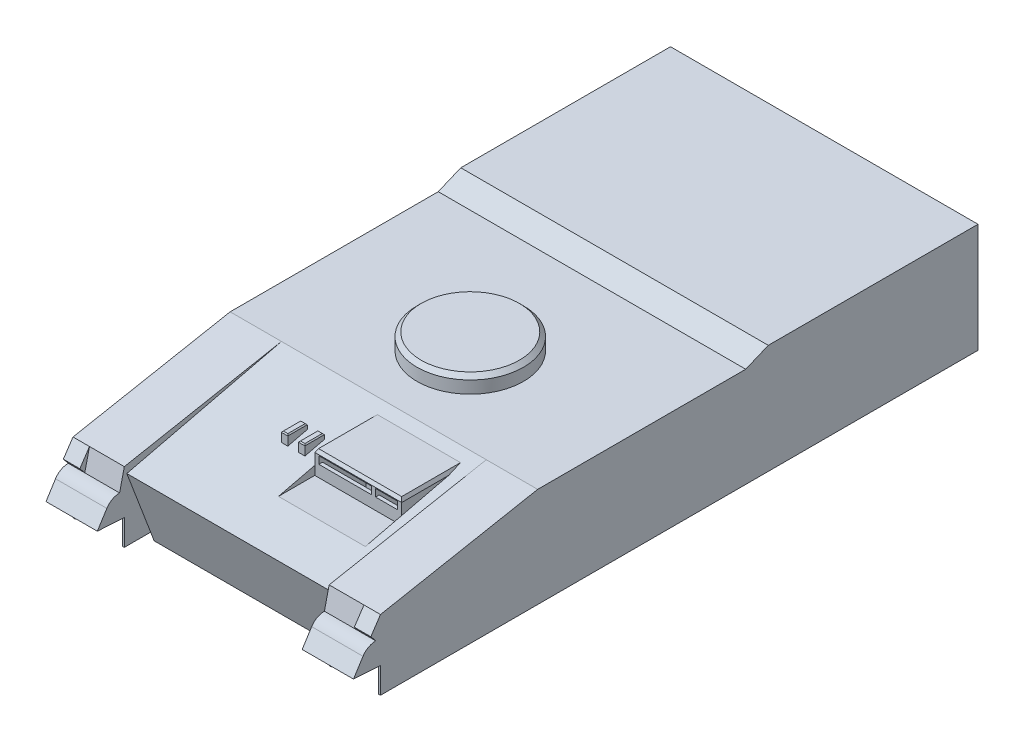
from build123d import *
from OCP.BRepAlgoAPI import BRepAlgoAPI_Cut
from OCP.TopTools import TopTools_ListOfShape
from OCP.BRepFilletAPI import BRepFilletAPI_MakeChamfer

# Parameters (mm, degrees)
BOSS_EXTRUDE1_DEPTH      = 193.56223071
BOSS_EXTRUDE1_DEPTH_BACK = 1265.039956588
SKETCH1_W                = 750.660133044
SKETCH1_H                = 349.862732427
SKETCH3_R                = 130
BOSS_EXTRUDE2_DEPTH      = 40
CUT_EXTRUDE1_DEPTH       = 1499.066357024
BOSS_EXTRUDE3_DEPTH      = 750.660133044
CHAMFER7_SIZE            = 10
BOSS_EXTRUDE4_DEPTH      = 750.660133044
CUT_EXTRUDE10_START      = -375.330067
CUT_EXTRUDE10_DEPTH      = 250
SKETCH22_W               = 125.330066522
SKETCH22_H               = 106.338336752
SKETCH22_W_2             = 115.330066522
SKETCH22_H_2             = 62.996013083
CUT_EXTRUDE11_DEPTH      = 1563.648643762
CUT_EXTRUDE12_REACH      = 1374.196
SKETCH24_W               = 115.330066522
SKETCH24_H               = 258.53466534
SKETCH25_W               = 115.330066522
SKETCH25_H               = 1190.067521958
CUT_EXTRUDE13_DEPTH      = 152.66709
BOSS_EXTRUDE5_REACH      = 1461.802
SKETCH27_W               = 212.123312066
SKETCH27_H               = 152.466183094
SKETCH28_W               = 148.280920275
SKETCH28_H               = 7.25471817
CUT_EXTRUDE14_DEPTH      = 212.123312065
SKETCH30_W               = 212.123312066
SKETCH30_H               = 21.209064542
CUT_EXTRUDE15_DEPTH      = 115
SKETCH31_W               = 128.313019002
SKETCH31_H               = 18.286786033
SKETCH31_W_2             = 53.810293064
CUT_EXTRUDE16_DEPTH      = 115
SKETCH32_W               = 128.313019002
SKETCH32_H               = 106.064247612
SKETCH32_W_2             = 53.810293064
CUT_EXTRUDE17_DEPTH      = 115
BOSS_EXTRUDE6_REACH      = 1500.066
CUT_EXTRUDE18_START      = -375.330067
CUT_EXTRUDE18_DEPTH      = 335
CHAMFER8_SIZE            = 8
CHAMFER8_SIZE2           = 4.618802154
BOSS_EXTRUDE7_REACH      = 1461.802
CHAMFER9_SIZE            = 2.5


with BuildPart() as part:
    # Sketch1 → Boss-Extrude1 (new, two sides: drawn at the far end of the back side and taken through both)
    with BuildSketch(Plane.XY.offset(-BOSS_EXTRUDE1_DEPTH_BACK)):
        with Locations((108.368558778, 68.593029462)):
            Rectangle(SKETCH1_W, SKETCH1_H)
    extrude(amount=BOSS_EXTRUDE1_DEPTH + BOSS_EXTRUDE1_DEPTH_BACK)

    # Sketch3 → Boss-Extrude2 (add)
    with BuildSketch(Plane(origin=(0, 243.524395675, 0), x_dir=(1, 0, 0), z_dir=(0, 1, 0))):
        with Locations(Location((108.368558778, 400.912813637, 0), (0, 0, 90))):
            Circle(SKETCH3_R)
    extrude(amount=BOSS_EXTRUDE2_DEPTH)

    # Sketch5 → Cut-Extrude1 (cut, through all)
    with BuildSketch(Plane(origin=(483.6986253, 0, 0), x_dir=(0, 0, -1), z_dir=(1, 0, 0))):
        Polygon((-193.56223071, 170.788945028), (190.086198144, 243.524395675), (-193.56223071, 243.524395675), align=None)
    extrude(amount=-CUT_EXTRUDE1_DEPTH, mode=Mode.SUBTRACT)

    # Sketch7 → Boss-Extrude3 (add)
    with BuildSketch(Plane(origin=(483.6986253, 0, 0), x_dir=(0, 0, -1), z_dir=(1, 0, 0))):
        Polygon((698.031406741, 243.524395675), (753.10995922, 266.522586582), (1265.039956588, 266.522586582), (1265.039956588, 243.524395675), align=None)
    extrude(amount=-BOSS_EXTRUDE3_DEPTH)

    # Chamfer7
    chamfer7_edges = [part.edges().sort_by_distance(p)[0] for p in [
        (108.368558778, 283.524395675, -270.912813637),
    ]]
    chamfer(chamfer7_edges, length=CHAMFER7_SIZE)

    # Sketch21 → Boss-Extrude4 (add)
    with BuildSketch(Plane.ZY.offset(266.961507744)):
        with BuildLine():
            Line((236.219336917, 103.762292304), (259.433344062, 67.111421995))
            Line((259.433344062, 67.111421995), (193.56223071, 62.996013083))
            Line((193.56223071, 62.996013083), (193.56223071, 120.885528527))
            Line((193.56223071, 120.885528527), (193.56223071, 170.788945028))
            Line((193.56223071, 170.788945028), (205.104812792, 120.885528527))
            ThreePointArc((205.104812792, 120.885528527), (222.862338171, 116.321994956), (236.219336917, 103.762292304))
        make_face()
    extrude(amount=-BOSS_EXTRUDE4_DEPTH)

    # Sketch20 → Cut-Extrude10 (cut, symmetric)
    with BuildSketch(Plane.ZY.offset(266.961507744).offset(CUT_EXTRUDE10_START)):
        Polygon((187.485453539, 153.18520382), (120.633916065, -22.69233968), (-169.800553019, -69.161854733), (-1166.369128547, -69.161854733), (-1265.039956588, 144.92983962), (-1265.039956588, -106.338336752), (316.242531376, -106.338336752), (316.242531376, 170.788945028), (193.56223071, 170.788945028), (-190.086198144, 243.524395675), align=None)
    extrude(amount=CUT_EXTRUDE10_DEPTH, both=True, mode=Mode.SUBTRACT)


with BuildPart() as cut_extrude11_tool:
    # Sketch22 → Cut-Extrude11 (new, through all)
    with BuildSketch(Plane.XY.offset(193.56223071)):
        with Locations((-204.296474483, -53.169168376)):
            Rectangle(SKETCH22_W, SKETCH22_H)
        with Locations((-204.296474483, 31.498006542)):
            Rectangle(SKETCH22_W_2, SKETCH22_H_2)
        with Locations((421.033592039, 31.498006542)):
            Rectangle(SKETCH22_W_2, SKETCH22_H_2)
        with Locations((421.033592039, -53.169168376)):
            Rectangle(SKETCH22_W, SKETCH22_H)
    extrude(amount=-CUT_EXTRUDE11_DEPTH)


with BuildPart() as part_1:
    add(part.part)

    # Cut-Extrude11: cut by cut_extrude11_tool, with a tolerance
    cut_extrude11_stock = TopTools_ListOfShape()
    cut_extrude11_stock.Append(part_1.part.wrapped)
    cut_extrude11_tools = TopTools_ListOfShape()
    cut_extrude11_tools.Append(cut_extrude11_tool.part.wrapped)
    cut_extrude11_cut = BRepAlgoAPI_Cut()
    cut_extrude11_cut.SetArguments(cut_extrude11_stock)
    cut_extrude11_cut.SetTools(cut_extrude11_tools)
    cut_extrude11_cut.SetFuzzyValue(0.00001)
    cut_extrude11_cut.Build()
    add(Compound.cast(cut_extrude11_cut.Shape()).solids(), mode=Mode.REPLACE)

    # Cut-Extrude12: up to this plane
    cut_extrude12_end = Plane(origin=(-266.961507744, 165.876452738, 192.630877123), z_dir=(0, -0.9824984579201473, -0.18627071746394425))
    # Sketch24 → Cut-Extrude12 (cut, up to the surface)
    with BuildSketch(Plane.XZ.offset(-62.996013083), mode=Mode.PRIVATE) as cut_extrude12_sk1:
        with Locations((-204.296474483, 59.29489804)):
            Rectangle(SKETCH24_W, SKETCH24_H)
    cut_extrude12_tool1 = split(extrude(cut_extrude12_sk1.sketch, amount=-CUT_EXTRUDE12_REACH, mode=Mode.PRIVATE), bisect_by=cut_extrude12_end, keep=Keep.BOTH, mode=Mode.PRIVATE)
    add(cut_extrude12_tool1.solids().sort_by_distance((-204.296474, 62.996013, 59.294898))[0], mode=Mode.SUBTRACT)
    # Sketch24 → Cut-Extrude12 (cut, up to the surface)
    with BuildSketch(Plane.XZ.offset(-62.996013083), mode=Mode.PRIVATE) as cut_extrude12_sk2:
        with Locations((421.033592039, 59.29489804)):
            Rectangle(SKETCH24_W, SKETCH24_H)
    cut_extrude12_tool2 = split(extrude(cut_extrude12_sk2.sketch, amount=-CUT_EXTRUDE12_REACH, mode=Mode.PRIVATE), bisect_by=cut_extrude12_end, keep=Keep.BOTH, mode=Mode.PRIVATE)
    add(cut_extrude12_tool2.solids().sort_by_distance((421.033592, 62.996013, 59.294898))[0], mode=Mode.SUBTRACT)

    # Sketch25 → Cut-Extrude13 (cut)
    with BuildSketch(Plane.XZ.offset(-62.996013083)):
        with Locations((-204.296474483, -665.006195609)):
            Rectangle(SKETCH25_W, SKETCH25_H)
        with Locations((421.033592039, -665.006195609)):
            Rectangle(SKETCH25_W, SKETCH25_H)
    extrude(amount=-CUT_EXTRUDE13_DEPTH, mode=Mode.SUBTRACT)

    # Boss-Extrude5: up to this plane
    boss_extrude5_end = Plane(origin=(-266.961507744, 243.524395675, 193.56223071), z_dir=(0, -1, 0))
    # Sketch27 → Boss-Extrude5 (add, up to the surface)
    with BuildSketch(Plane(origin=(0, 187.320129902, 44.818908088), x_dir=(1, 0, 0), z_dir=(0, 0.9725495665123397, 0.2326958114721023)), mode=Mode.PRIVATE) as boss_extrude5_sk1:
        with Locations((224.274258106, 134.125433145)):
            Rectangle(SKETCH27_W, SKETCH27_H)
    boss_extrude5_tool1 = split(extrude(boss_extrude5_sk1.sketch, amount=BOSS_EXTRUDE5_REACH, dir=(0, 1, 0), mode=Mode.PRIVATE), bisect_by=boss_extrude5_end, keep=Keep.BOTH, mode=Mode.PRIVATE)
    add(boss_extrude5_tool1.solids().sort_by_distance((224.274258, 218.530556, -85.624724))[0])

    # Sketch28 → Cut-Extrude14 (cut)
    with BuildSketch(Plane.ZY.offset(-118.212602073)):
        with Locations((-85.624723776, 239.89703659)):
            Rectangle(SKETCH28_W, SKETCH28_H)
    extrude(amount=-CUT_EXTRUDE14_DEPTH, mode=Mode.SUBTRACT)

    # Sketch30 → Cut-Extrude15 (cut)
    with BuildSketch(Plane.XY.offset(-11.484263638)):
        with Locations((224.274258106, 190.186903037)):
            Rectangle(SKETCH30_W, SKETCH30_H)
    extrude(amount=CUT_EXTRUDE15_DEPTH, mode=Mode.SUBTRACT)

    # Sketch31 → Cut-Extrude16 (cut)
    with BuildSketch(Plane.XY.offset(-11.484263638)):
        with Locations((192.369111574, 217.126284489)):
            Rectangle(SKETCH31_W, SKETCH31_H)
        with Locations((293.430767607, 217.126284489)):
            Rectangle(SKETCH31_W_2, SKETCH31_H)
    extrude(amount=-CUT_EXTRUDE16_DEPTH, mode=Mode.SUBTRACT)

    # Sketch32 → Cut-Extrude17 (cut)
    with BuildSketch(Plane(origin=(0, 207.982891472, 0), x_dir=(1, 0, 0), z_dir=(0, 1, 0))):
        with Locations((192.369111574, 73.452139832)):
            Rectangle(SKETCH32_W, SKETCH32_H)
        with Locations((293.430767607, 73.452139832)):
            Rectangle(SKETCH32_W_2, SKETCH32_H)
    extrude(amount=-CUT_EXTRUDE17_DEPTH, mode=Mode.SUBTRACT)

    # Boss-Extrude6: up to this face of the body (flat: up to its plane)
    boss_extrude6_end = Plane(part_1.part.faces().sort_by_distance((483.6986253, 122.340997746, -568.947125817))[0])
    # Sketch34 → Boss-Extrude6 (add, up to the picked face)
    with BuildSketch(Plane.ZY.offset(266.961507744), mode=Mode.PRIVATE) as boss_extrude6_sk1:
        Polygon((193.56223071, 170.788945028), (217.146727568, 135.603005806), (205.104812792, 120.885528527), align=None)
    boss_extrude6_tool1 = split(extrude(boss_extrude6_sk1.sketch, amount=-BOSS_EXTRUDE6_REACH, mode=Mode.PRIVATE), bisect_by=boss_extrude6_end, keep=Keep.BOTH, mode=Mode.PRIVATE)
    add(boss_extrude6_tool1.solids().sort_by(Axis((-266.961508, 142.425826, 205.271257), (1, 0, 0)))[0])

    # Sketch35 → Cut-Extrude18 (cut, symmetric)
    with BuildSketch(Plane.ZY.offset(266.961507744).offset(CUT_EXTRUDE18_START)):
        Polygon((205.104812792, 120.885528527), (193.56223071, 170.788945028), (217.146727568, 135.603005806), align=None)
    extrude(amount=CUT_EXTRUDE18_DEPTH, both=True, mode=Mode.SUBTRACT)

    # Chamfer8: one chamfer whose edges measure the first distance from different faces: ONE call of the kernel's chamfer builder (chamfer() names one face for all edges)
    chamfer8_edges_1 = [part_1.edges().sort_by_distance(p)[0] for p in [
        (224.274258106, 236.269677505, -11.484263638),
    ]]
    chamfer8_side_1 = [part_1.faces().sort_by_distance(p)[0] for p in [
        (225.057773378, 204.40173967, -11.484263638),
    ]]
    chamfer8_edges_2 = [part_1.edges().sort_by_distance(p)[0] for p in [
        (118.212602073, 236.269677505, -85.624723775),
    ]]
    chamfer8_side_2 = [part_1.faces().sort_by_distance(p)[0] for p in [
        (118.212602073, 224.443596773, -60.911237063),
    ]]
    chamfer8_edges_3 = [part_1.edges().sort_by_distance(p)[0] for p in [
        (330.335914138, 236.269677505, -85.624723775),
    ]]
    chamfer8_side_3 = [part_1.faces().sort_by_distance(p)[0] for p in [
        (330.335914139, 224.443596773, -60.911237063),
    ]]
    chamfer8 = BRepFilletAPI_MakeChamfer(part_1.part.solid().wrapped)
    for e in chamfer8_edges_1:
        chamfer8.Add(CHAMFER8_SIZE, CHAMFER8_SIZE2, e.wrapped, chamfer8_side_1[0].wrapped)  # the first distance lies on this face
    for e in chamfer8_edges_2:
        chamfer8.Add(CHAMFER8_SIZE, CHAMFER8_SIZE2, e.wrapped, chamfer8_side_2[0].wrapped)  # the first distance lies on this face
    for e in chamfer8_edges_3:
        chamfer8.Add(CHAMFER8_SIZE, CHAMFER8_SIZE2, e.wrapped, chamfer8_side_3[0].wrapped)  # the first distance lies on this face
    add(Compound.cast(chamfer8.Shape()), mode=Mode.REPLACE)

    # Boss-Extrude7: up to this plane
    boss_extrude7_end = Plane(origin=(478.794198695, 226.269677505, -159.765183913), z_dir=(0, -1, 0))
    # Sketch36 → Boss-Extrude7 (add, up to the surface)
    with BuildSketch(Plane(origin=(0, 187.320129902, 44.818908088), x_dir=(1, 0, 0), z_dir=(0, 0.9725495665123397, 0.2326958114721023)), mode=Mode.PRIVATE) as boss_extrude7_sk1:
        Polygon((72.068248118, 64.286413464), (87.971069757, 64.286413464), (87.971069757, 113.140659417), (72.068248118, 113.140659417), (72.068248118, 96.084936844), align=None)
    boss_extrude7_tool1 = split(extrude(boss_extrude7_sk1.sketch, amount=BOSS_EXTRUDE7_REACH, dir=(0, 1, 0), mode=Mode.PRIVATE), bisect_by=boss_extrude7_end, keep=Keep.BOTH, mode=Mode.PRIVATE)
    add(boss_extrude7_tool1.solids().sort_by_distance((80.019659, 207.963398, -41.459403))[0])
    # Sketch36 → Boss-Extrude7 (add, up to the surface)
    with BuildSketch(Plane(origin=(0, 187.320129902, 44.818908088), x_dir=(1, 0, 0), z_dir=(0, 0.9725495665123397, 0.2326958114721023)), mode=Mode.PRIVATE) as boss_extrude7_sk2:
        Polygon((30.247215503, 64.286413464), (46.150037141, 64.286413464), (46.150037141, 96.084936844), (46.150037141, 113.140659417), (30.247215503, 113.140659417), align=None)
    boss_extrude7_tool2 = split(extrude(boss_extrude7_sk2.sketch, amount=BOSS_EXTRUDE7_REACH, dir=(0, 1, 0), mode=Mode.PRIVATE), bisect_by=boss_extrude7_end, keep=Keep.BOTH, mode=Mode.PRIVATE)
    add(boss_extrude7_tool2.solids().sort_by_distance((38.198626, 207.963398, -41.459403))[0])

    # Chamfer9
    chamfer9_edges = [part_1.edges().sort_by_distance(p)[0] for p in [
        (80.019658938, 226.269677505, -65.215991183),
        (87.971069757, 226.269677505, -41.459403321),
        (72.068248118, 226.269677505, -41.459403321),
        (80.019658938, 226.269677505, -17.702815459),
        (38.198626322, 226.269677505, -65.215991183),
        (46.150037141, 226.269677505, -41.459403321),
        (30.247215503, 226.269677505, -41.459403321),
        (38.198626322, 226.269677505, -17.702815459),
    ]]
    chamfer(chamfer9_edges, length=CHAMFER9_SIZE)


solid = part_1.part
